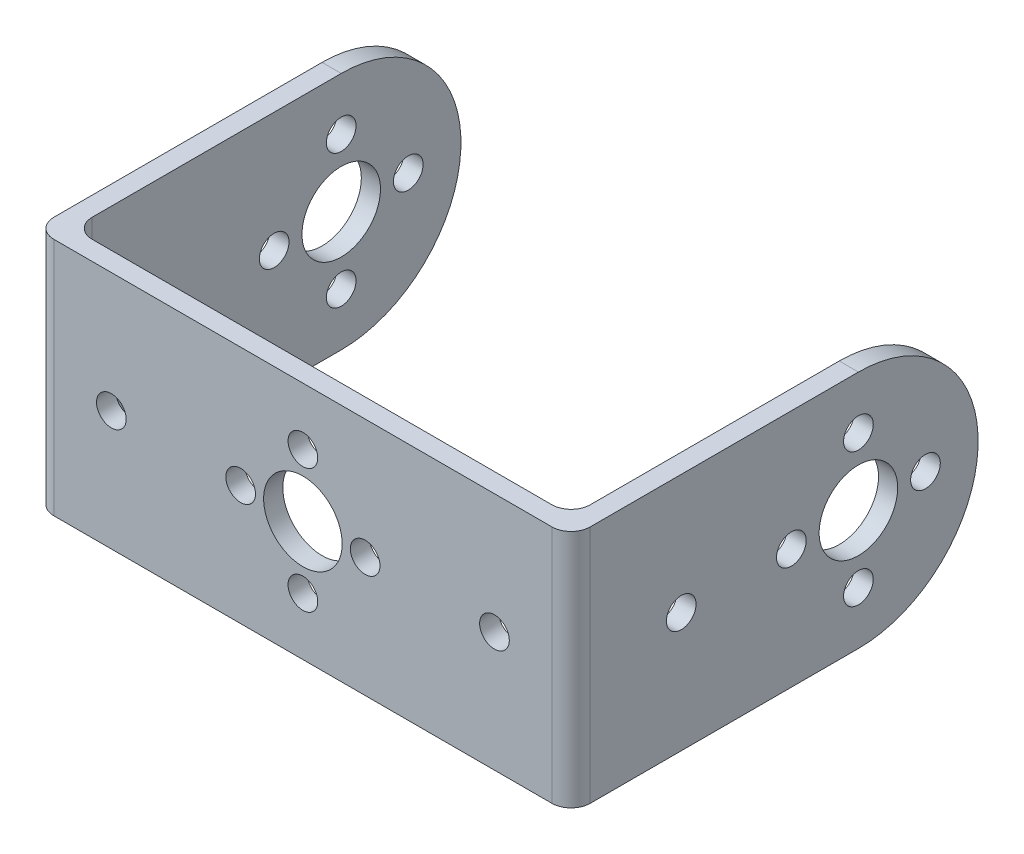
from build123d import *

# Parameters (mm, degrees)
SKETCH_1_W            = 56
SKETCH_1_H            = 25
EXTRUDE_1_DEPTH       = 2
EXTRUDE_START         = -2
EXTRUDE_2_OUTLINE_R   = 1.55
EXTRUDE_2_OUTLINE_R_2 = 4.1
EXTRUDE_2_DEPTH       = 2
SKETCH_3_R            = 1.55
SKETCH_3_R_2          = 4.1
CUT_EXTRUDE_1_DEPTH   = 2
FILLET_1_R            = 2


# Read off the part's stored shape, not the designer's step: 凸台-拉伸2
with BuildPart() as part:
    # 草图1 → 凸台-拉伸1 (new body)
    with BuildSketch(Plane.XY):
        Rectangle(SKETCH_1_W, SKETCH_1_H)
    extrude(amount=EXTRUDE_1_DEPTH)

    # 凸台-拉伸2 outline → 凸台-拉伸2 (add)
    with BuildSketch(Plane(origin=(28, 0, 0), x_dir=(0, 0, -1), z_dir=(1, 0, 0)).offset(EXTRUDE_START)):
        with BuildLine():
            Line((0, -12.5), (28, -12.5))
            ThreePointArc((28, -12.5), (40.5, 0), (28, 12.5))
            Line((28, 12.5), (0, 12.5))
            Line((0, 12.5), (0, -12.5))
        make_face()
        with Locations((28, -7)):
            Circle(EXTRUDE_2_OUTLINE_R, mode=Mode.SUBTRACT)
        with Locations((9.5, 0)):
            Circle(EXTRUDE_2_OUTLINE_R, mode=Mode.SUBTRACT)
        with Locations((21, 0)):
            Circle(EXTRUDE_2_OUTLINE_R, mode=Mode.SUBTRACT)
        with Locations((28, 0)):
            Circle(EXTRUDE_2_OUTLINE_R_2, mode=Mode.SUBTRACT)
        with Locations((35, 0)):
            Circle(EXTRUDE_2_OUTLINE_R, mode=Mode.SUBTRACT)
        with Locations((28, 7)):
            Circle(EXTRUDE_2_OUTLINE_R, mode=Mode.SUBTRACT)
    extrude_2 = extrude(amount=EXTRUDE_2_DEPTH)

    # 镜向2: 凸台-拉伸2 across plane
    add(extrude_2.mirror(Plane.ZY))

    # 草图3 → 切除-拉伸1 (cut)
    with BuildSketch(Plane.XY.offset(2)):
        with Locations((-20, 0)):
            Circle(SKETCH_3_R)
        with Locations((-6.5, 0)):
            Circle(SKETCH_3_R)
        with Locations((6.5, 0)):
            Circle(SKETCH_3_R)
        with Locations((0, -6.5)):
            Circle(SKETCH_3_R)
        Circle(SKETCH_3_R_2)
        with Locations((0, 6.5)):
            Circle(SKETCH_3_R)
        with Locations((20, 0)):
            Circle(SKETCH_3_R)
    extrude(amount=-CUT_EXTRUDE_1_DEPTH, mode=Mode.SUBTRACT)

    # 圆角1
    fillet_1_edges = [part.edges().sort_by_distance(p)[0] for p in [
        (-28, 0, 2),
        (26, 0, 0),
        (-26, 0, 0),
        (28, 0, 2),
    ]]
    fillet(fillet_1_edges, radius=FILLET_1_R)


solid = part.part
